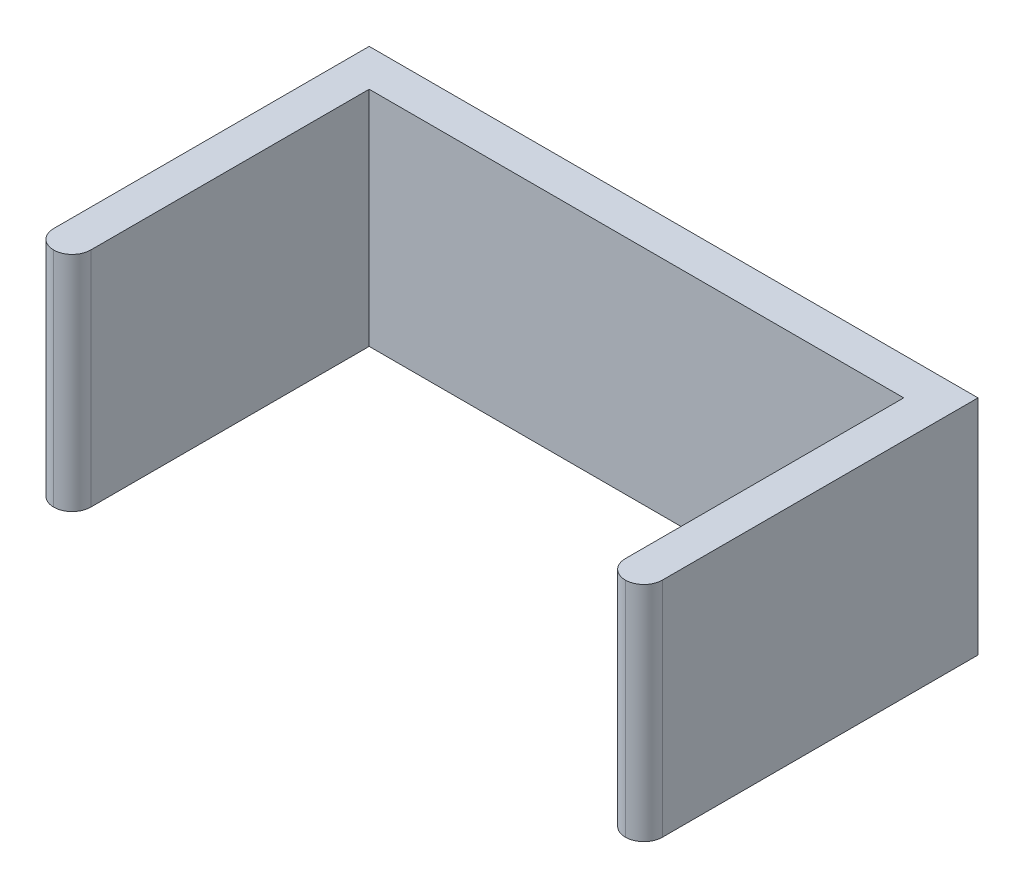
from build123d import *

# Parameters (mm, degrees)
SKETCH_1_W      = 82
SKETCH_1_H      = 30
EXTRUDE_1_DEPTH = 5
SKETCH_2_W      = 5
SKETCH_2_H      = 30
EXTRUDE_2_DEPTH = 40
FILLET_1_R      = 2.5


with BuildPart() as part:
    # 草圖1 → 填料-伸長1 (new body)
    with BuildSketch(Plane.XY):
        with Locations((8.53492865, 4.8)):
            Rectangle(SKETCH_1_W, SKETCH_1_H)
    extrude(amount=EXTRUDE_1_DEPTH)

    # 草圖2 → 填料-伸長2 (add)
    with BuildSketch(Plane.XY.offset(5)):
        with Locations((-29.96507135, 4.8)):
            Rectangle(SKETCH_2_W, SKETCH_2_H)
        with Locations((47.03492865, 4.8)):
            Rectangle(SKETCH_2_W, SKETCH_2_H)
    extrude(amount=EXTRUDE_2_DEPTH)

    # 圓角1
    fillet_1_edges = [part.edges().sort_by_distance(p)[0] for p in [
        (44.53492865, 4.8, 45),
        (-27.46507135, 4.8, 45),
        (49.53492865, 4.8, 45),
        (-32.46507135, 4.8, 45),
    ]]
    fillet(fillet_1_edges, radius=FILLET_1_R - 0.0001)  # a hair under: the kernel refuses the full size


solid = part.part
